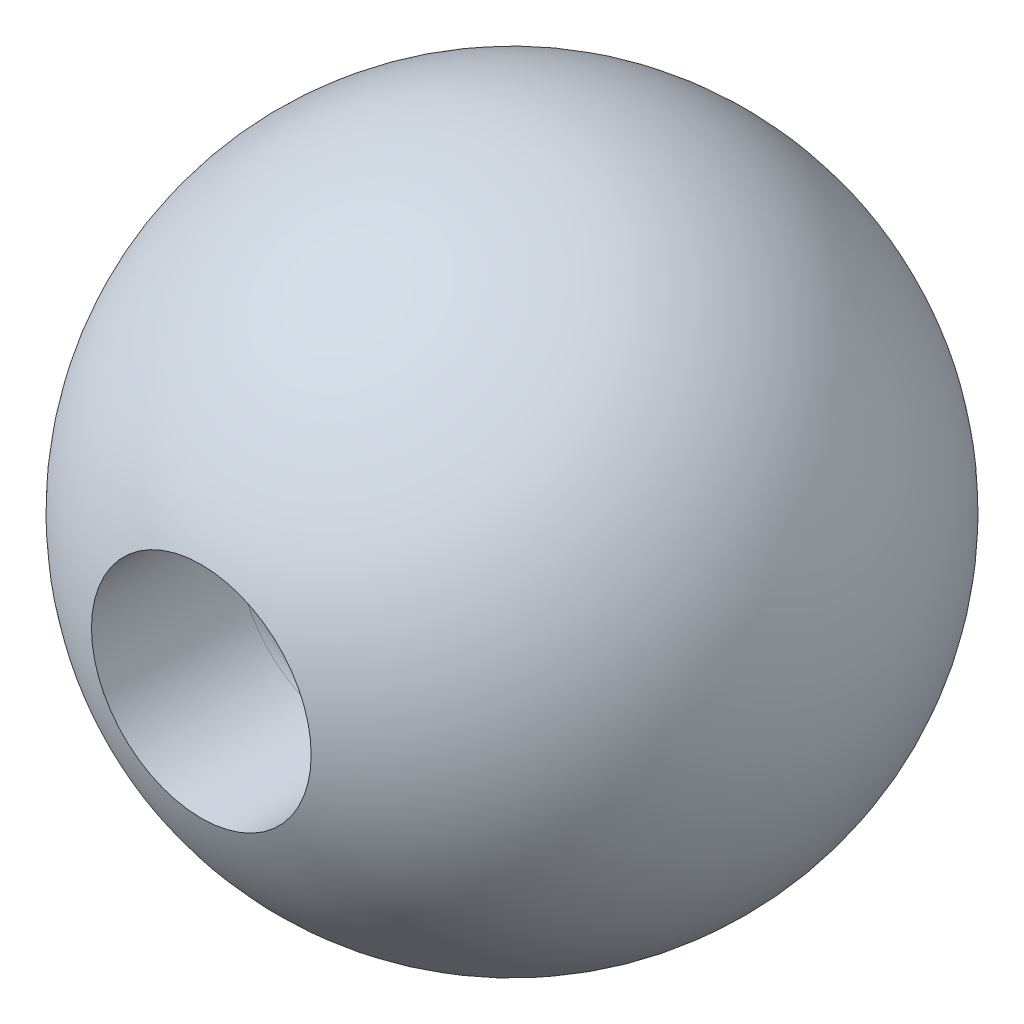
from build123d import *

# Parameters (mm, degrees)
FILLET1_R = 0.25


# Read off the part's stored shape, not the designer's step: Shell1
with BuildPart() as part:
    # Sketch1 → Revolve1 (revolve)
    with BuildSketch(Plane(origin=(0, 0, 0), x_dir=(1, 0, 0), z_dir=(0, 1, 0)), mode=Mode.PRIVATE) as revolve1_sk:
        with BuildLine():
            Line((0, 1), (-0.5, 1))
            Line((-0.5, 1), (-0.5, 0.085786438))
            ThreePointArc((-0.5, 0.085786438), (-1.478397839, 1.753652968), (0, 3))
            Line((0, 3), (0, 1))
        make_face()
    revolve(revolve1_sk.sketch.rotate(Axis((0, 0, -4.268887564), (0, 0, 1)), 180), axis=Axis((0, 0, -4.268887564), (0, 0, 1)))

    # Shell1 outline → Shell1 (revolve, cut)
    with BuildSketch(Plane.XZ):
        with BuildLine():
            Line((0.866025403, -1), (0, -0.999999999))
            Line((0, -0.999999999), (0, -2.5))
            ThreePointArc((0, -2.5), (0.866025404, -2), (0.866025403, -1))
        make_face()
    revolve(axis=Axis((0, 0, 0), (0, 0, 1)), mode=Mode.SUBTRACT)

    # Fillet1
    fillet1_edges = [part.edges().sort_by_distance(p)[0] for p in [
        (-0.5, 0, -1),
    ]]
    fillet(fillet1_edges, radius=FILLET1_R)


solid = part.part
